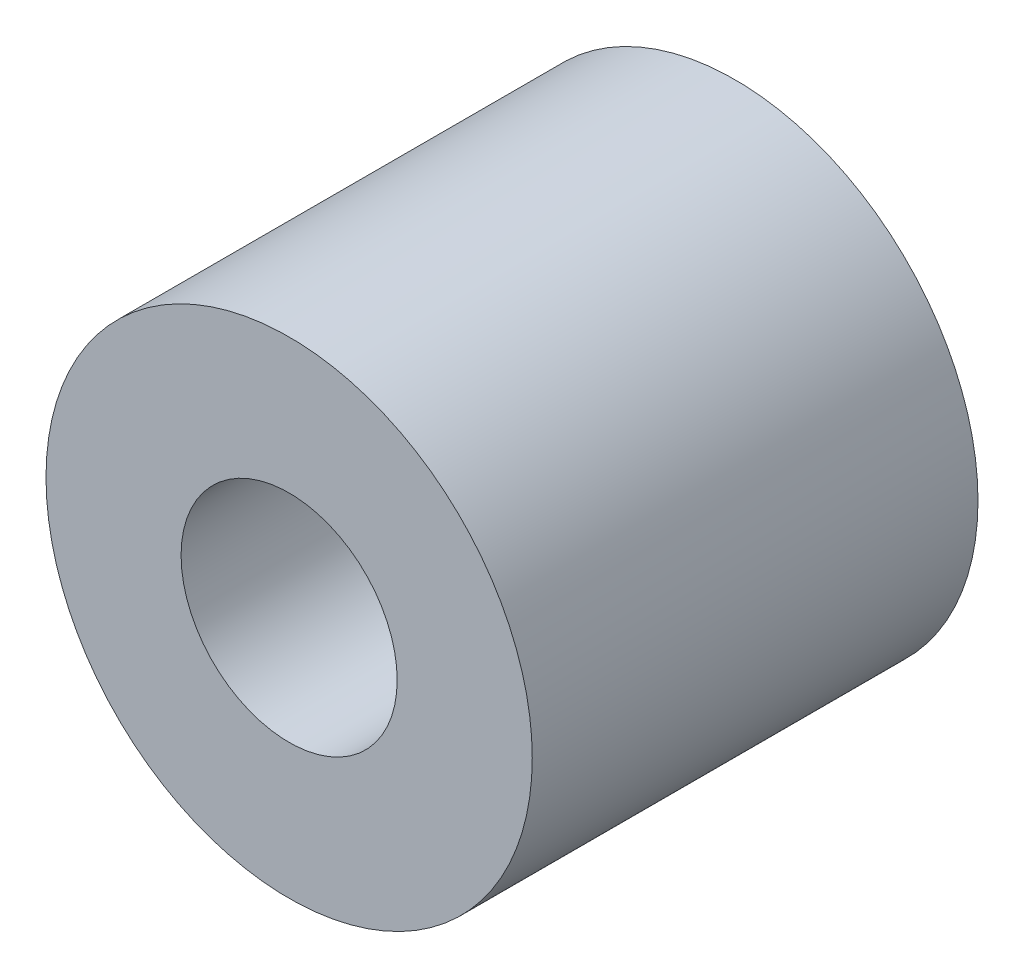
from build123d import *

# Parameters (mm, degrees)
SKIZZE1_R                       = 9
AUFSATZ_LINEAR_AUSTRAGEN1_DEPTH = 16.5
SCHNITT_LINEAR_AUSTRAGEN1_REACH = 22.839
SKIZZE2_R                       = 4


with BuildPart() as part:
    # Skizze1 → Aufsatz-Linear austragen1 (new body)
    with BuildSketch(Plane(origin=(0, 0, 0), x_dir=(0, 1, 0), z_dir=(0, 0, 1))):
        Circle(SKIZZE1_R)
    extrude(amount=AUFSATZ_LINEAR_AUSTRAGEN1_DEPTH)

    # Skizze2 → Schnitt-Linear austragen1 (cut, up to next)
    with BuildSketch(Plane.XY.offset(16.5), mode=Mode.PRIVATE) as schnitt_linear_austragen1_sk1:
        Circle(SKIZZE2_R)
    schnitt_linear_austragen1_tool1 = extrude(schnitt_linear_austragen1_sk1.sketch, amount=-SCHNITT_LINEAR_AUSTRAGEN1_REACH, mode=Mode.PRIVATE) & part.part
    add(schnitt_linear_austragen1_tool1.solids().sort_by_distance((0, 0, 16.5))[0], mode=Mode.SUBTRACT)


solid = part.part
